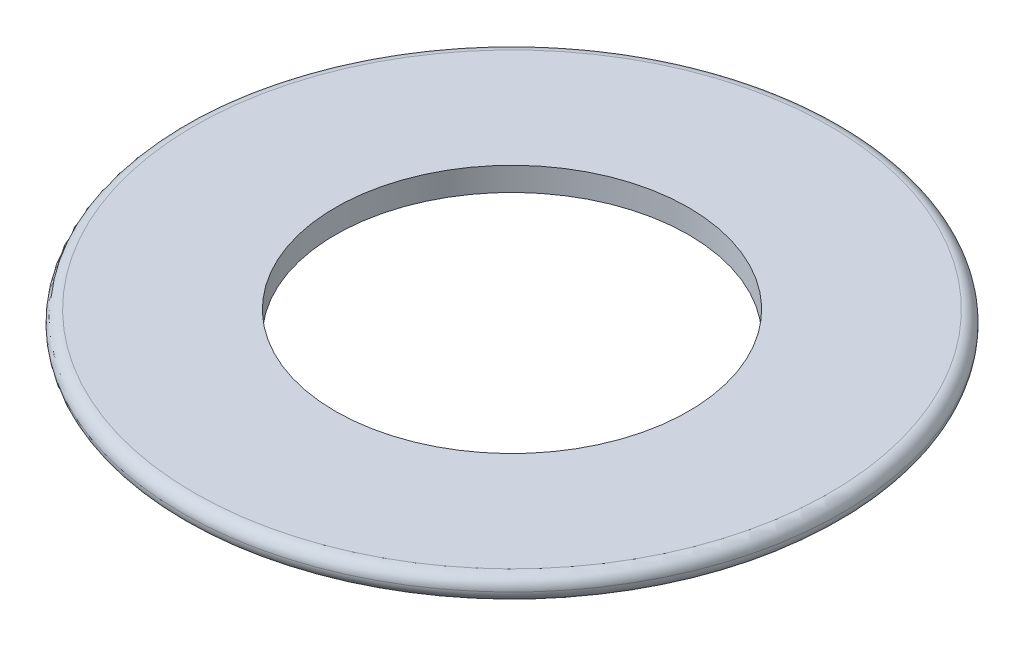
from build123d import *

# Parameters (mm, degrees)
SKETCH1_R           = 14
SKETCH1_R_2         = 7.5
BOSS_EXTRUDE1_DEPTH = 1
FILLET1_R           = 0.5


with BuildPart() as part:
    # Sketch1 → Boss-Extrude1 (new body)
    with BuildSketch(Plane(origin=(0, 0, 0), x_dir=(1, 0, 0), z_dir=(0, 1, 0))):
        with Locations(Location((0, 0, 0), (0, 0, 270))):
            Circle(SKETCH1_R)
        with Locations(Location((0, 0, 0), (0, 0, 270))):
            Circle(SKETCH1_R_2, mode=Mode.SUBTRACT)
    extrude(amount=BOSS_EXTRUDE1_DEPTH)

    # Fillet1
    fillet1_edges = [part.edges().sort_by_distance(p)[0] for p in [
        (0, 0, -14),
        (0, 1, -14),
    ]]
    fillet(fillet1_edges, radius=FILLET1_R - 0.0001)  # a hair under: the kernel refuses the full size


solid = part.part
